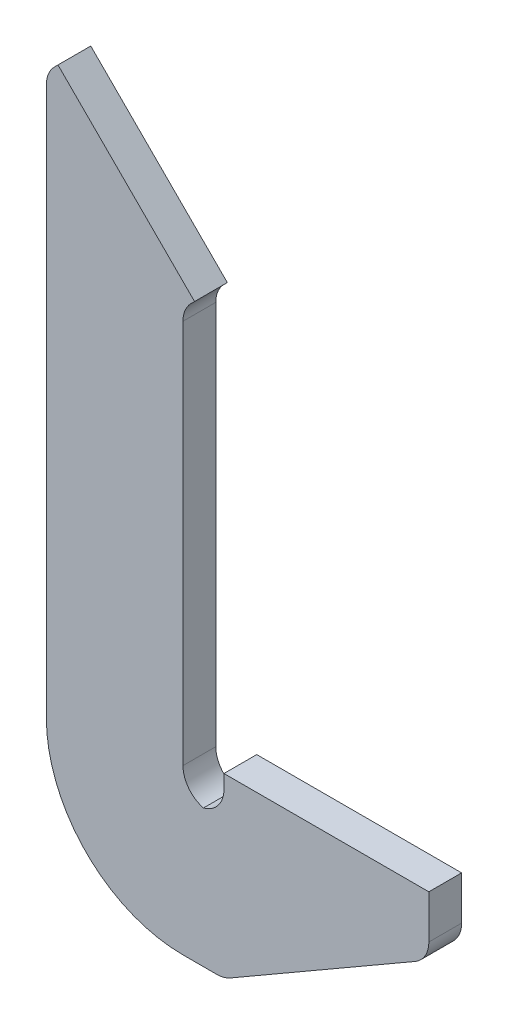
from build123d import *

# Parameters (mm, degrees)
BOSS_EXTRUDE1_DEPTH = 0.12
FILLET1_R           = 1
FILLET2_R           = 0.2


with BuildPart() as part:
    # Sketch1 → Boss-Extrude1 (new, symmetric)
    with BuildSketch(Plane.XY):
        Polygon((0, 0), (-1.5, 0), (-1.5, -0.3), (-1.8, -0.3), (-1.8, 2.8), (-1.715147186, 2.884852814), (-2.715147186, 3.884852814), (-2.8, 3.8), (-2.8, -1.3), (-1.5, -1.3), (0, -0.433974596), align=None)
    extrude(amount=BOSS_EXTRUDE1_DEPTH, both=True)

    # Fillet1
    fillet1_edges = [part.edges().sort_by_distance(p)[0] for p in [
        (-2.8, -1.3, 0),
    ]]
    fillet(fillet1_edges, radius=FILLET1_R)

    # Fillet2
    # the kernel refuses this fillet: 0.2 mm, written as the material it adds along each edge
    with BuildSketch(Plane(origin=(-1.8, 2.8, -0.12), x_dir=(0.7071067811865476, 0.7071067811865476, 0), z_dir=(0, 0, 1))) as fillet2_piece_1:
        with BuildLine():
            CenterArc((FILLET2_R * 0.414213562373, -FILLET2_R), FILLET2_R, 90, 45)
            Line((-FILLET2_R * 0.292893218813, -FILLET2_R * 0.292893218813), (0, 0))
            Line((0, 0), (FILLET2_R * 0.414213562373, 0))
        make_face()
    extrude(amount=0.24)
    with BuildSketch(Plane(origin=(-1.5, -0.3, -0.12), x_dir=(-1, 0, 0), z_dir=(0, 0, 1)), Plane(origin=(-1.8, -0.3, -0.12), x_dir=(0, 1, 0), z_dir=(0, 0, 1))) as fillet2_piece_2:
        with BuildLine():
            CenterArc((FILLET2_R, -FILLET2_R), FILLET2_R, 90, 90)
            Line((0, -FILLET2_R), (0, 0))
            Line((0, 0), (FILLET2_R, 0))
        make_face()
    extrude(amount=0.24)
    # the kernel refuses this fillet: 0.2 mm, written as the material it takes off along each edge
    with BuildSketch(Plane(origin=(-2.8, 3.8, -0.327106781), x_dir=(0, -1, 0), z_dir=(0, 0, 1))) as fillet2_2_piece_1:
        with BuildLine():
            CenterArc((FILLET2_R * 0.414213562373, FILLET2_R), FILLET2_R, 225, 45)
            Line((-FILLET2_R * 0.292893218813, FILLET2_R * 0.292893218813), (0, 0))
            Line((0, 0), (FILLET2_R * 0.414213562373, 0))
        make_face()
    extrude(amount=0.654213562, mode=Mode.SUBTRACT)
    with BuildSketch(Plane(origin=(-1.5, -1.3, 0.253974596), x_dir=(-1, 0, 0), z_dir=(0, 0, -1))) as fillet2_2_piece_2:
        with BuildLine():
            CenterArc((FILLET2_R * 0.267949192431, FILLET2_R), FILLET2_R, 240, 30)
            Line((-FILLET2_R * 0.232050807569, FILLET2_R * 0.133974596216), (0, 0))
            Line((0, 0), (FILLET2_R * 0.267949192431, 0))
        make_face()
    extrude(amount=0.507949192, mode=Mode.SUBTRACT)
    with BuildSketch(Plane(origin=(0, -0.433974596, 0.408675135), x_dir=(-0.8660254037844399, -0.4999999999999978, 0), z_dir=(0, 0, -1))) as fillet2_2_piece_3:
        with BuildLine():
            CenterArc((FILLET2_R * 0.57735026919, FILLET2_R), FILLET2_R, 210, 60)
            Line((-FILLET2_R * 0.288675134595, FILLET2_R * 0.5), (0, 0))
            Line((0, 0), (FILLET2_R * 0.57735026919, 0))
        make_face()
    extrude(amount=0.817350269, mode=Mode.SUBTRACT)


solid = part.part
